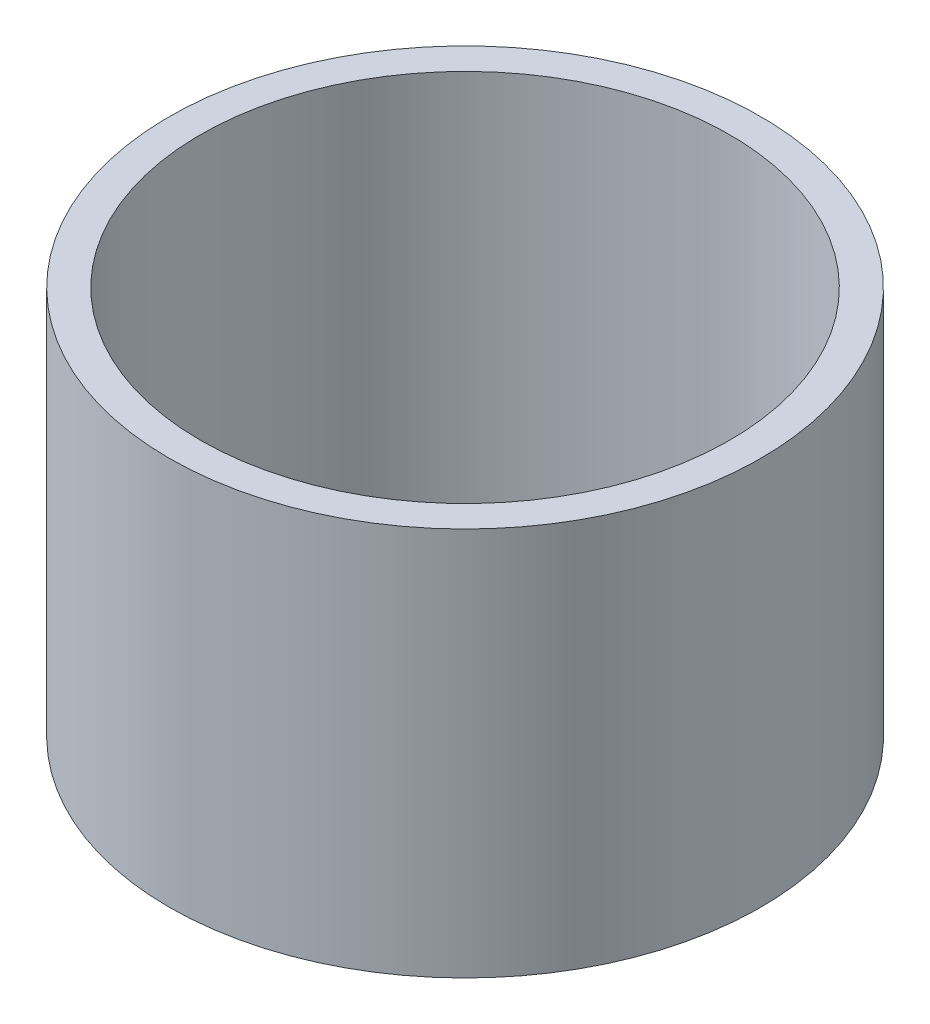
from build123d import *

# Parameters (mm, degrees)
SKETCH1_R           = 35
BOSS_EXTRUDE1_DEPTH = 45.999128557
SKETCH2_R           = 31.310109407
CUT_EXTRUDE1_DEPTH  = 68.571590392


with BuildPart() as part:
    # Sketch1 → Boss-Extrude1 (new body)
    with BuildSketch(Plane(origin=(0, 0, 0), x_dir=(1, 0, 0), z_dir=(0, 1, 0))):
        Circle(SKETCH1_R)
    extrude(amount=BOSS_EXTRUDE1_DEPTH)

    # Sketch2 → Cut-Extrude1 (cut, through all)
    with BuildSketch(Plane(origin=(0, 0, 0), x_dir=(1, 0, 0), z_dir=(0, 1, 0))):
        Circle(SKETCH2_R)
    extrude(amount=CUT_EXTRUDE1_DEPTH, mode=Mode.SUBTRACT)


solid = part.part
